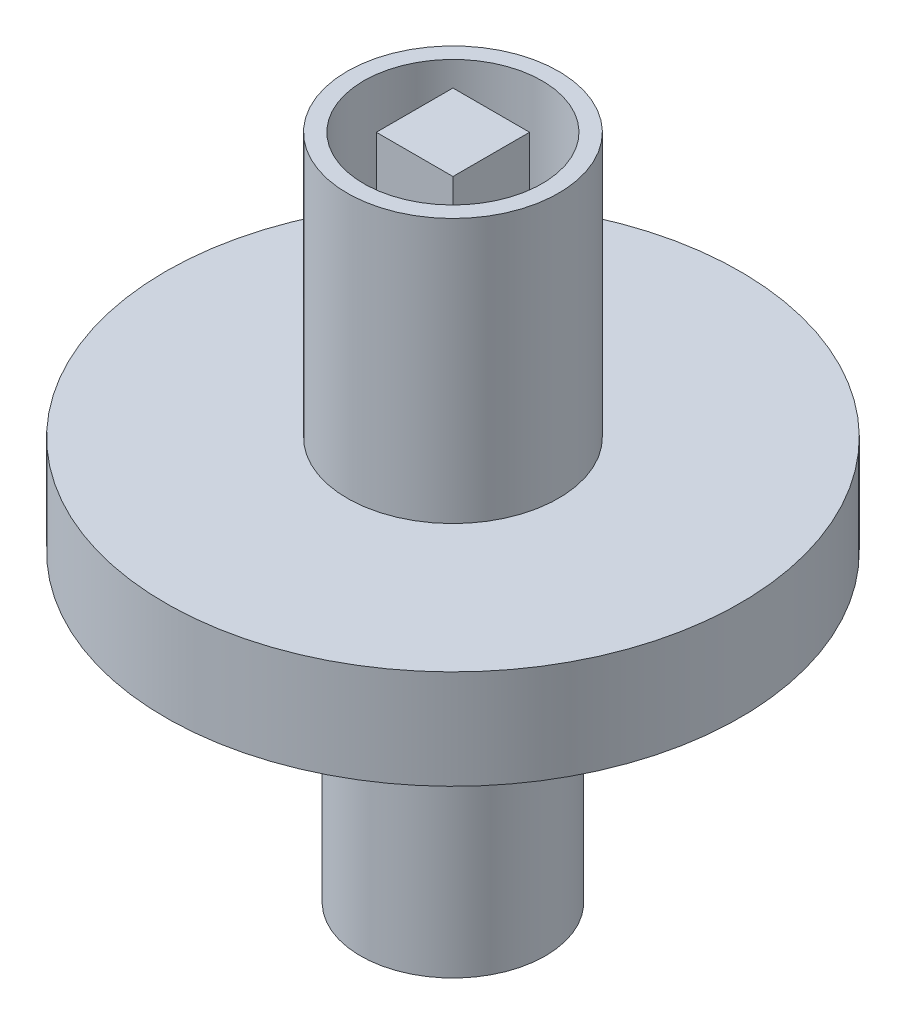
from build123d import *

# Parameters (mm, degrees)
SKETCH3_R           = 6.75
CUT_EXTRUDE1_DEPTH  = 15
SKETCH4_W           = 5.8
SKETCH4_H           = 5.8
BOSS_EXTRUDE1_DEPTH = 15
SKETCH6_R           = 7
BOSS_EXTRUDE2_DEPTH = 23
SKETCH7_R           = 3.5
CUT_EXTRUDE2_DEPTH  = 15
CUT_EXTRUDE3_DEPTH  = 15


with BuildPart() as part:
    # Sketch2 → Revolve2 (revolve)
    with BuildSketch(Plane.XY):
        Polygon((21.75, 0), (21.75, 7.5), (8, 7.5), (8, 27.5), (0, 27.5), (0, 0), align=None)
    revolve(axis=Axis((0, 96.27972973, 0), (0, -1, 0)))

    # Sketch3 → Cut-Extrude1 (cut)
    with BuildSketch(Plane(origin=(0, 27.5, 0), x_dir=(1, 0, 0), z_dir=(0, 1, 0))):
        Circle(SKETCH3_R)
    extrude(amount=-CUT_EXTRUDE1_DEPTH, mode=Mode.SUBTRACT)

    # Sketch4 → Boss-Extrude1 (add)
    with BuildSketch(Plane(origin=(0, 12.5, 0), x_dir=(1, 0, 0), z_dir=(0, 1, 0))):
        with Locations((0.004761868, -0.002625461)):
            Rectangle(SKETCH4_W, SKETCH4_H)
    extrude(amount=BOSS_EXTRUDE1_DEPTH)

    # Sketch6 → Boss-Extrude2 (add)
    with BuildSketch(Plane.XZ):
        Circle(SKETCH6_R)
    extrude(amount=BOSS_EXTRUDE2_DEPTH)

    # Sketch7 → Cut-Extrude2 (cut)
    with BuildSketch(Plane.XZ.offset(23)):
        Circle(SKETCH7_R)
    extrude(amount=-CUT_EXTRUDE2_DEPTH, mode=Mode.SUBTRACT)

    # Sketch8 → Cut-Extrude3 (cut)
    with BuildSketch(Plane.XZ.offset(23)):
        Polygon((-5.3, 1.5), (-1.5, 1.5), (-1.5, 5.3), (1.5, 5.3), (1.5, 1.5), (5.3, 1.5), (5.3, -1.5), (1.5, -1.5), (1.5, -5.3), (-1.5, -5.3), (-1.5, -1.5), (-5.3, -1.5), align=None)
    extrude(amount=-CUT_EXTRUDE3_DEPTH, mode=Mode.SUBTRACT)


solid = part.part
